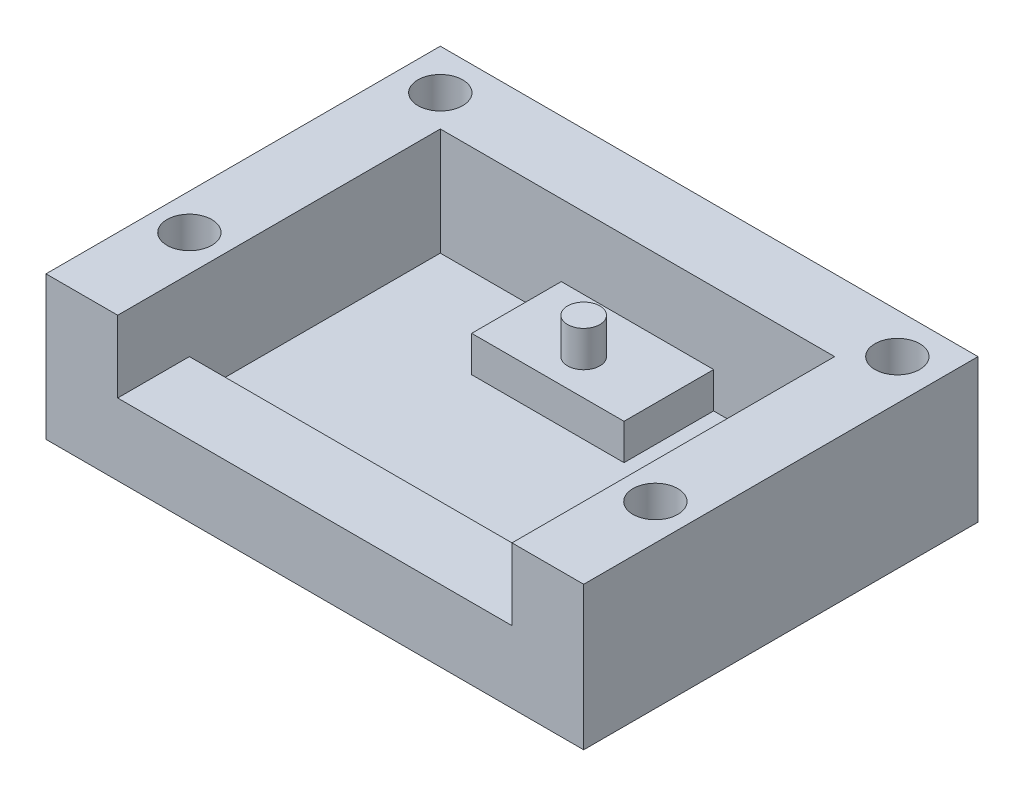
from build123d import *

# Parameters (mm, degrees)
ESQUISSE3_W             = 30
ESQUISSE3_H             = 22
BOSS_EXTRU_1_DEPTH      = 8
ESQUISSE4_W             = 22
ESQUISSE4_H             = 14
ENL_V_MAT_EXTRU_1_DEPTH = 6
ESQUISSE5_W             = 22
ESQUISSE5_H             = 4
ENL_V_MAT_EXTRU_2_DEPTH = 4
ESQUISSE7_R             = 0.9
BOSS_EXTRU_2_DEPTH      = 4
ESQUISSE9_R             = 1.25
ENL_V_MAT_EXTRU_3_DEPTH = 2
ESQUISSE11_R            = 1.25
ENL_V_MAT_EXTRU_4_DEPTH = 2
ESQUISSE12_W            = 8.5
ESQUISSE12_H            = 5
BOSS_EXTRU_3_DEPTH      = 2


with BuildPart() as part:
    # Esquisse3 → Boss.-Extru.1 (new body)
    with BuildSketch(Plane(origin=(0, 0, 0), x_dir=(1, 0, 0), z_dir=(0, 1, 0))):
        with Locations((-15, -11)):
            Rectangle(ESQUISSE3_W, ESQUISSE3_H)
    extrude(amount=BOSS_EXTRU_1_DEPTH)

    # Esquisse4 → Enlèv. mat.-Extru.1 (cut)
    with BuildSketch(Plane(origin=(0, 8, 0), x_dir=(1, 0, 0), z_dir=(0, 1, 0))):
        with Locations((-15, -11)):
            Rectangle(ESQUISSE4_W, ESQUISSE4_H)
    extrude(amount=-ENL_V_MAT_EXTRU_1_DEPTH, mode=Mode.SUBTRACT)

    # Esquisse5 → Enlèv. mat.-Extru.2 (cut)
    with BuildSketch(Plane(origin=(0, 8, 0), x_dir=(1, 0, 0), z_dir=(0, 1, 0))):
        with Locations((-15, -20)):
            Rectangle(ESQUISSE5_W, ESQUISSE5_H)
    extrude(amount=-ENL_V_MAT_EXTRU_2_DEPTH, mode=Mode.SUBTRACT)

    # Esquisse7 → Boss.-Extru.2 (add)
    with BuildSketch(Plane(origin=(0, 2, 0), x_dir=(1, 0, 0), z_dir=(0, 1, 0))):
        with Locations((-15, -7)):
            Circle(ESQUISSE7_R)
    extrude(amount=BOSS_EXTRU_2_DEPTH)

    # Esquisse9 → Enlèv. mat.-Extru.3 (cut)
    with BuildSketch(Plane(origin=(0, 8, 0), x_dir=(1, 0, 0), z_dir=(0, 1, 0))):
        with Locations((-27.75, -2.25)):
            Circle(ESQUISSE9_R)
    enl_v_mat_extru_3 = extrude(amount=-ENL_V_MAT_EXTRU_3_DEPTH, mode=Mode.SUBTRACT)

    # Symétrie1: Enlèv. mat.-Extru.3 across plane
    add(enl_v_mat_extru_3.mirror(Plane.ZY.offset(15)), mode=Mode.SUBTRACT)

    # Esquisse11 → Enlèv. mat.-Extru.4 (cut)
    with BuildSketch(Plane(origin=(0, 8, 0), x_dir=(1, 0, 0), z_dir=(0, 1, 0))):
        with Locations((-28, -16)):
            Circle(ESQUISSE11_R)
    enl_v_mat_extru_4 = extrude(amount=-ENL_V_MAT_EXTRU_4_DEPTH, mode=Mode.SUBTRACT)

    # Symétrie2: Enlèv. mat.-Extru.4 across plane
    add(enl_v_mat_extru_4.mirror(Plane.ZY.offset(15)), mode=Mode.SUBTRACT)

    # Esquisse12 → Boss.-Extru.3 (add)
    with BuildSketch(Plane(origin=(0, 2, 0), x_dir=(1, 0, 0), z_dir=(0, 1, 0))):
        with Locations((-15, -6.5)):
            Rectangle(ESQUISSE12_W, ESQUISSE12_H)
    extrude(amount=BOSS_EXTRU_3_DEPTH)


solid = part.part
